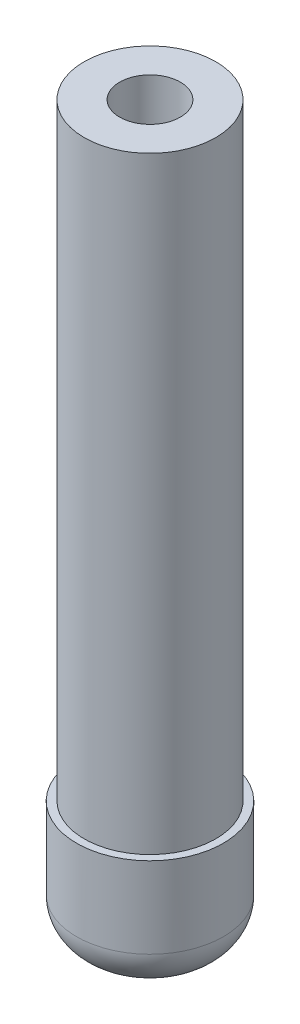
from build123d import *

# Parameters (mm, degrees)
SKETCH1_R                      = 6.5
BOSS_EXTRUDE1_DEPTH            = 60
SKETCH2_R                      = 3
INNER_CHAMBER_DEPTH            = 52.5
SKETCH4_R                      = 7.25
BOSS_EXTRUDE2_DEPTH            = 10
SKETCH5_R                      = 7.25
BOSS_EXTRUDE3_DEPTH            = 2
FILLET3_SIZE                   = 4
CUT_EXTRUDE2_REACH             = 62.87
SKETCH6_W                      = 4
SKETCH6_H                      = 3.5
CUT_EXTRUDE2_DIRECTION_2_DEPTH = 5


with BuildPart() as part:
    # Sketch1 → Boss-Extrude1 (new body)
    with BuildSketch(Plane(origin=(0, 0, 0), x_dir=(1, 0, 0), z_dir=(0, 1, 0))):
        with Locations(Location((0, 0, 0), (0, 0, 270))):
            Circle(SKETCH1_R)
    extrude(amount=BOSS_EXTRUDE1_DEPTH)

    # Sketch2 → Inner Chamber (cut)
    with BuildSketch(Plane(origin=(0, 60, 0), x_dir=(1, 0, 0), z_dir=(0, 1, 0))):
        with Locations(Location((0, 0, 0), (0, 0, 270))):
            Circle(SKETCH2_R)
    extrude(amount=-INNER_CHAMBER_DEPTH, mode=Mode.SUBTRACT)

    # Sketch4 → Boss-Extrude2 (add)
    with BuildSketch(Plane.XZ):
        with Locations(Location((0, 0, 0), (0, 0, 270))):
            Circle(SKETCH4_R)
    extrude(amount=BOSS_EXTRUDE2_DEPTH)

    # Sketch5 → Boss-Extrude3 (add)
    with BuildSketch(Plane.XZ.offset(10)):
        with Locations(Location((0, 0, 0), (0, 0, 270))):
            Circle(SKETCH5_R)
    extrude(amount=BOSS_EXTRUDE3_DEPTH)

    # Fillet3
    # a fillet whose section is not a circle: 4 mm, written as the material it takes off along each edge
    with BuildSketch(Plane(origin=(0, -12, 0), x_dir=(0, 0, -1), z_dir=(-1, 0, 0))) as fillet3_piece_1:
        with BuildLine():
            Bezier((7.25, -FILLET3_SIZE), (7.25, 0), (7.25 - FILLET3_SIZE, 0), weights=[1, 0.666666667, 1])
            Line((7.25 - FILLET3_SIZE, 0), (7.25, 0))
            Line((7.25, 0), (7.25, -FILLET3_SIZE))
        make_face()
    revolve(axis=Axis((0, -12, 0), (0, -1, 0)), mode=Mode.SUBTRACT)

    # Sketch6 → Cut-Extrude2 (cut, up to next)
    with BuildSketch(Plane.XY, mode=Mode.PRIVATE) as cut_extrude2_sk1:
        with Locations((0, -8)):
            Rectangle(SKETCH6_W, SKETCH6_H)
    cut_extrude2_tool1 = extrude(cut_extrude2_sk1.sketch, amount=-CUT_EXTRUDE2_REACH, mode=Mode.PRIVATE) & part.part
    add(cut_extrude2_tool1.solids().sort_by_distance((0, -8, 0))[0], mode=Mode.SUBTRACT)

    # Sketch6 → Cut-Extrude2 direction 2 (cut)
    with BuildSketch(Plane.XY):
        with Locations((0, -8)):
            Rectangle(SKETCH6_W, SKETCH6_H)
    extrude(amount=CUT_EXTRUDE2_DIRECTION_2_DEPTH, mode=Mode.SUBTRACT)


solid = part.part
